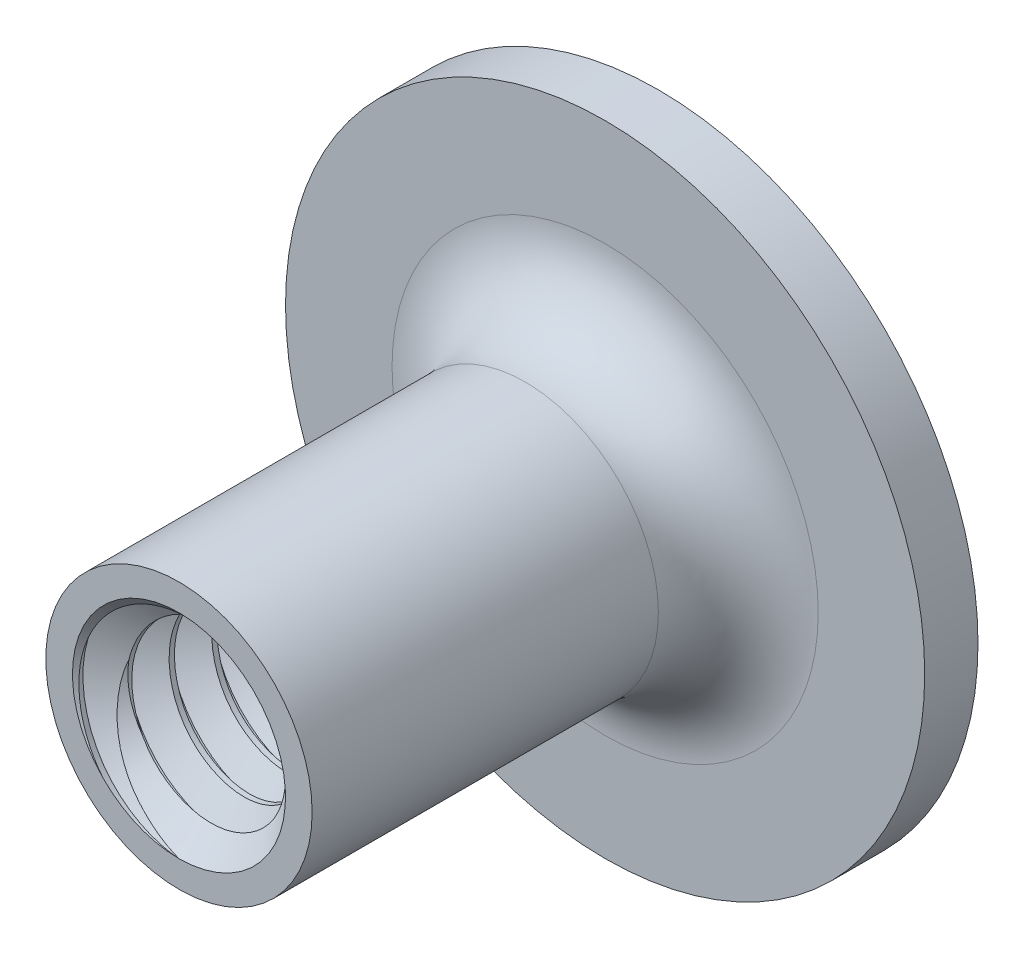
from build123d import *

# Parameters (mm, degrees)
SKETCH1_R          = 9.525
SKETCH1_R_2        = 3.175
EXTRUDE1_DEPTH     = 1.5875
SKETCH2_R          = 3.96875
SKETCH2_R_2        = 3.175
EXTRUDE2_DEPTH     = 12.7
SWEEP1_PITCH       = 1.27
SKETCH5_R          = 9.525
CUT_EXTRUDE1_DEPTH = 21.81999955
SKETCH7_R          = 3.96875
CUT_EXTRUDE3_DEPTH = 20.636290615
FILLET1_R          = 2.38125


with BuildPart() as part:
    # Sketch1 → Extrude1 (new body)
    with BuildSketch(Plane.XY):
        Circle(SKETCH1_R)
        Circle(SKETCH1_R_2, mode=Mode.SUBTRACT)
    extrude(amount=EXTRUDE1_DEPTH)

    # Sketch2 → Extrude2 (add)
    with BuildSketch(Plane.XY.offset(1.5875)):
        Circle(SKETCH2_R)
        Circle(SKETCH2_R_2, mode=Mode.SUBTRACT)
    extrude(amount=EXTRUDE2_DEPTH)

    # Sweep1: the profile of Sketch4 profile screwed along a right-hand helix of 12.5 turns, 6 arcs to a turn; built about Z, then put on its axis
    sweep1_z = Axis((0, 0, 0), (0, 0, 1))
    sweep1_corners = [(3.1753, 0, -1.111423205), (3.1753, 0, 0.000173205), (2.350110803, 0, -0.47625), (2.350110803, 0, -0.635)]
    with BuildLine(mode=Mode.PRIVATE) as sweep1_profile:
        Line(sweep1_corners[0], sweep1_corners[1])
        Line(sweep1_corners[1], sweep1_corners[2])
        Line(sweep1_corners[2], sweep1_corners[3])
        Line(sweep1_corners[3], sweep1_corners[0])
    sweep1_cap = Face(sweep1_profile.wire())
    sweep1_turn_angles = [0, 30, 60, 90, 120, 150, 180, 210, 240, 270, 300, 330, 360]
    sweep1_turn_weights = [1, 0.8660254037844387, 1, 0.8660254037844387, 1, 0.8660254037844387, 1, 0.8660254037844387, 1, 0.8660254037844387, 1, 0.8660254037844387, 1]
    sweep1_turn_rails = [Edge.make_bspline([Vector(p[0], p[1], 0).rotate(sweep1_z, sweep1_turn_angles[k]) / sweep1_turn_weights[k] + Vector(0, 0, p[2] + SWEEP1_PITCH * sweep1_turn_angles[k] / 360) for k in range(13)], [0, 0, 0, 1, 1, 2, 2, 3, 3, 4, 4, 5, 5, 6, 6, 6], 2, sweep1_turn_weights) for p in sweep1_corners]
    sweep1_turn_sides = [Face.make_surface_from_curves(sweep1_turn_rails[p[0]], sweep1_turn_rails[p[1]]) for p in [(0, 1), (1, 2), (2, 3), (3, 0)]]
    sweep1_last_angles = [4320, 4350, 4380, 4410, 4440, 4470, 4500]
    sweep1_last_weights = [1, 0.8660254037844387, 1, 0.8660254037844387, 1, 0.8660254037844228, 1]
    sweep1_last_rails = [Edge.make_bspline([Vector(p[0], p[1], 0).rotate(sweep1_z, sweep1_last_angles[k]) / sweep1_last_weights[k] + Vector(0, 0, p[2] + SWEEP1_PITCH * sweep1_last_angles[k] / 360) for k in range(7)], [0, 0, 0, 1, 1, 2, 2, 3, 3, 3], 2, sweep1_last_weights) for p in sweep1_corners]
    sweep1_last_sides = [Face.make_surface_from_curves(sweep1_last_rails[p[0]], sweep1_last_rails[p[1]]) for p in [(0, 1), (1, 2), (2, 3), (3, 0)]]
    sweep1 = Plane(origin=(0, 0, 0), x_dir=(-1, 0, 0), z_dir=(0, 0, 1)) * Solid(Shell([*[p.moved(Location((0, 0, SWEEP1_PITCH * i))) for i in range(12) for p in sweep1_turn_sides], *sweep1_last_sides, sweep1_cap, sweep1_cap.rotate(sweep1_z, 4500).moved(Location((0, 0, SWEEP1_PITCH * 4500 / 360)))]))
    add(sweep1)

    # Sketch5 → Cut-Extrude1 (cut, through all)
    with BuildSketch(Plane(origin=(0, 0, 0), x_dir=(-1, 0, 0), z_dir=(0, 0, -1))):
        with Locations(Location((0, 0, 0), (0, 0, 180))):
            Circle(SKETCH5_R)
    extrude(amount=CUT_EXTRUDE1_DEPTH, mode=Mode.SUBTRACT)

    # Cut-Extrude2 cone 1 section (through the dimple's axis) → Cut-Extrude2 (revolve, cut)
    with BuildSketch(Plane.YZ):
        Polygon((0, 0), (3.175, 0), (0, 3.175), align=None)
    revolve(axis=Axis((0, 0, 0), (0, 0, 1)), mode=Mode.SUBTRACT)

    # Sketch7 → Cut-Extrude3 (cut, through all)
    with BuildSketch(Plane.XY.offset(14.2875)):
        Circle(SKETCH7_R)
    extrude(amount=CUT_EXTRUDE3_DEPTH, mode=Mode.SUBTRACT)

    # Cut-Extrude4 cone 1 section (through the dimple's axis) → Cut-Extrude4 (revolve, cut)
    with BuildSketch(Plane(origin=(0, 0, 14.2875), x_dir=(0, -1, 0), z_dir=(1, 0, 0))):
        Polygon((0, 0), (3.175, 0), (0, 3.175), align=None)
    revolve(axis=Axis((0, 0, 14.2875), (0, 0, -1)), mode=Mode.SUBTRACT)

    # Fillet1
    fillet1_edges = [part.edges().sort_by_distance(p)[0] for p in [
        (-3.96875, 0, 1.5875),
    ]]
    fillet(fillet1_edges, radius=FILLET1_R)


solid = part.part
